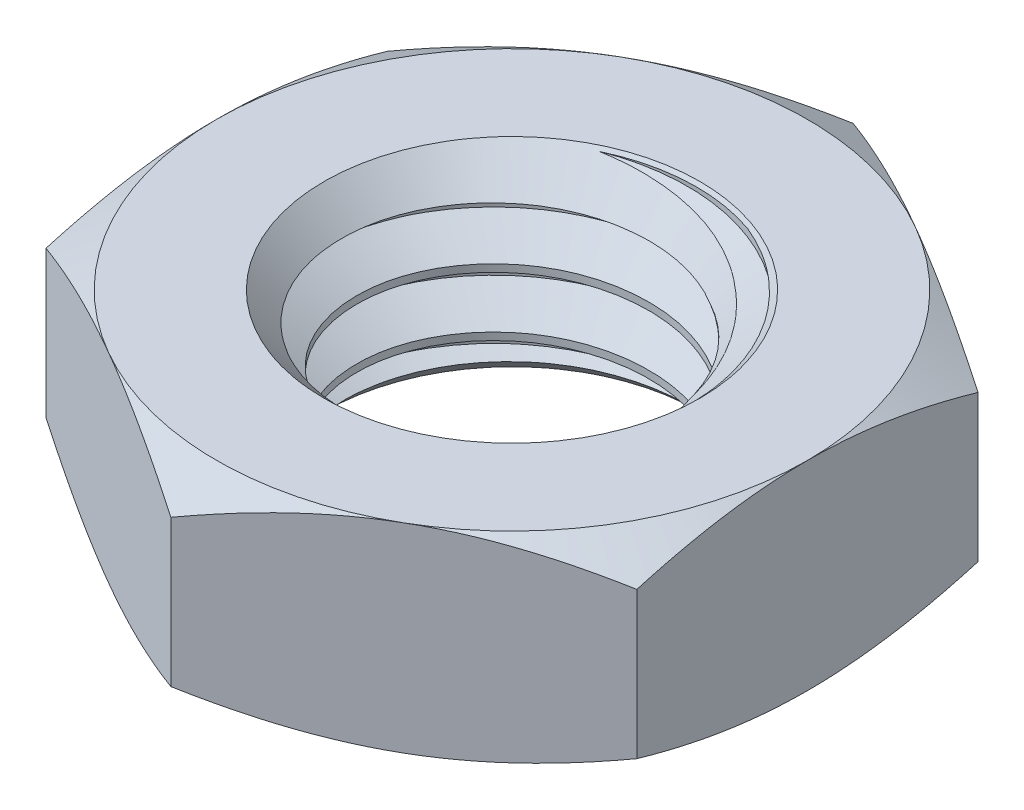
from build123d import *

# Parameters (mm, degrees)
SKETCH1_R                    = 2.5
BOSS_EXTRUDE1_DEPTH          = 1.35
SKETCH5_OUTSIDE_W            = 39.108
SKETCH5_OUTSIDE_H            = 40.346
SKETCH5_OUTSIDE_R            = 4
CUT_EXTRUDE2_DEPTH           = 7.68006986
CUT_EXTRUDE2_DRAFT           = -60
MIRROR1_COPY_1_SKETCH_W      = 39.108
MIRROR1_COPY_1_SKETCH_H      = 40.346
MIRROR1_COPY_1_SKETCH_R      = 4
MIRROR1_COPY_1_DEPTH         = 7.68006986
MIRROR1_COPY_1_DRAFT         = -60
SWEEP1_PITCH                 = 0.8
SKETCH4_R                    = 2.54330127
CUT_EXTRUDE1_DEPTH           = 8.054003107
CUT_EXTRUDE1_OTHER_WAY_DEPTH = 8.054003107
CUT_EXTRUDE1_OTHER_WAY_DRAFT = -45
MIRROR2_COPY_1_SKETCH_R      = 2.54330127
MIRROR2_COPY_1_DEPTH         = 8.054003107
MIRROR2_COPY_1_DRAFT         = -45
MIRROR2_COPY_2_SKETCH_R      = 2.54330127
MIRROR2_COPY_2_DEPTH         = 8.054003107
MIRROR2_COPY_2_DRAFT         = -45


with BuildPart() as part:
    # Sketch1 → Boss-Extrude1 (new, symmetric)
    with BuildSketch(Plane(origin=(0, 0, 0), x_dir=(1, 0, 0), z_dir=(0, 1, 0))):
        Polygon((-4, 2.309401077), (-4, -2.309401077), (0, -4.618802154), (4, -2.309401077), (4, 2.309401077), (0, 4.618802154), align=None)
        with Locations(Location((0, 0, 0), (0, 0, 90))):
            Circle(SKETCH1_R, mode=Mode.SUBTRACT)
    extrude(amount=BOSS_EXTRUDE1_DEPTH, both=True)


with BuildPart() as cut_extrude2_tool:
    # Sketch5 outside → Cut-Extrude2 (with draft: the straight prism first)
    with BuildSketch(Plane(origin=(0, 1.35, 0), x_dir=(1, 0, 0), z_dir=(0, 1, 0))):
        Rectangle(SKETCH5_OUTSIDE_W, SKETCH5_OUTSIDE_H)
        Circle(SKETCH5_OUTSIDE_R, mode=Mode.SUBTRACT)
    extrude(amount=-CUT_EXTRUDE2_DEPTH)
    # Cut-Extrude2: the draft: its side faces are tilted about the plane it starts from
    cut_extrude2_sides = [cut_extrude2_tool.faces().sort_by_distance(p)[0] for p in [
        (0, -2.49003493, 20.173),
        (19.554, -2.49003493, 0),
        (0, -2.49003493, -20.173),
        (-19.554, -2.49003493, 0),
        (-4, -2.49003493, 0),
    ]]
    draft(cut_extrude2_sides, Plane(origin=(0, 1.35, 0), x_dir=(1, 0, 0), z_dir=(0, 1, 0)), CUT_EXTRUDE2_DRAFT)


with BuildPart() as part_1:
    add(part.part)

    # Cut-Extrude2: cut by cut_extrude2_tool
    add(cut_extrude2_tool.part, mode=Mode.SUBTRACT)


with BuildPart() as mirror1_copy_1_tool:
    # Mirror1 copy 1 sketch → Mirror1 copy 1 (with draft: the straight prism first)
    with BuildSketch(Plane.XZ.offset(1.35)):
        Rectangle(MIRROR1_COPY_1_SKETCH_W, MIRROR1_COPY_1_SKETCH_H)
        Circle(MIRROR1_COPY_1_SKETCH_R, mode=Mode.SUBTRACT)
    extrude(amount=-MIRROR1_COPY_1_DEPTH)
    # Mirror1 copy 1: the draft: its side faces are tilted about the plane it starts from
    mirror1_copy_1_sides = [mirror1_copy_1_tool.faces().sort_by_distance(p)[0] for p in [
        (0, 2.49003493, 20.173),
        (19.554, 2.49003493, 0),
        (0, 2.49003493, -20.173),
        (-19.554, 2.49003493, 0),
        (-4, 2.49003493, 0),
    ]]
    draft(mirror1_copy_1_sides, Plane.XZ.offset(1.35), MIRROR1_COPY_1_DRAFT)


with BuildPart() as part_2:
    add(part_1.part)

    # Mirror1 copy 1: cut by mirror1_copy_1_tool
    add(mirror1_copy_1_tool.part, mode=Mode.SUBTRACT)

    # Sweep1: arcs per turn and ends read off the stored shape
    # Sweep1: the profile of Sketch3 screwed along a right-hand helix through 4.375 turns, 8 arcs to a turn; built about Z, then put on its axis
    sweep1_z = Axis((0, 0, 0), (0, 0, 1))
    sweep1_corners = [(1.980384758, 0, -0.3), (1.980384758, 0, -0.4), (2.54330127, 0, -0.725), (2.54330127, 0, 0.025)]
    with BuildLine(mode=Mode.PRIVATE) as sweep1_profile:
        Line(sweep1_corners[0], sweep1_corners[1])
        Line(sweep1_corners[1], sweep1_corners[2])
        Line(sweep1_corners[2], sweep1_corners[3])
        Line(sweep1_corners[3], sweep1_corners[0])
    sweep1_cap = Face(sweep1_profile.wire())
    sweep1_turn_angles = [0, 22.5, 45, 67.5, 90, 112.5, 135, 157.5, 180, 202.5, 225, 247.5, 270, 292.5, 315, 337.5, 360]
    sweep1_turn_weights = [1, 0.9238795325112867, 1, 0.9238795325112867, 1, 0.9238795325112867, 1, 0.9238795325112867, 1, 0.9238795325112867, 1, 0.9238795325112867, 1, 0.9238795325112867, 1, 0.9238795325112867, 1]
    sweep1_turn_rails = [Edge.make_bspline([Vector(p[0], p[1], 0).rotate(sweep1_z, sweep1_turn_angles[k]) / sweep1_turn_weights[k] + Vector(0, 0, p[2] + SWEEP1_PITCH * sweep1_turn_angles[k] / 360) for k in range(17)], [0, 0, 0, 1, 1, 2, 2, 3, 3, 4, 4, 5, 5, 6, 6, 7, 7, 8, 8, 8], 2, sweep1_turn_weights) for p in sweep1_corners]
    sweep1_turn_sides = [Face.make_surface_from_curves(sweep1_turn_rails[p[0]], sweep1_turn_rails[p[1]]) for p in [(0, 1), (1, 2), (2, 3), (3, 0)]]
    sweep1_last_angles = [1440, 1462.5, 1485, 1507.5, 1530, 1552.5, 1575]
    sweep1_last_weights = [1, 0.9238795325112867, 1, 0.9238795325112867, 1, 0.9238795325112776, 1]
    sweep1_last_rails = [Edge.make_bspline([Vector(p[0], p[1], 0).rotate(sweep1_z, sweep1_last_angles[k]) / sweep1_last_weights[k] + Vector(0, 0, p[2] + SWEEP1_PITCH * sweep1_last_angles[k] / 360) for k in range(7)], [0, 0, 0, 1, 1, 2, 2, 3, 3, 3], 2, sweep1_last_weights) for p in sweep1_corners]
    sweep1_last_sides = [Face.make_surface_from_curves(sweep1_last_rails[p[0]], sweep1_last_rails[p[1]]) for p in [(0, 1), (1, 2), (2, 3), (3, 0)]]
    sweep1 = Plane(origin=(0, 1.35, 0), x_dir=(0, 0, -1), z_dir=(0, -1, 0)) * Solid(Shell([*[p.moved(Location((0, 0, SWEEP1_PITCH * i))) for i in range(4) for p in sweep1_turn_sides], *sweep1_last_sides, sweep1_cap, sweep1_cap.rotate(sweep1_z, 1575).moved(Location((0, 0, SWEEP1_PITCH * 1575 / 360)))]))
    add(sweep1)

    # Sketch4 → Cut-Extrude1 (cut)
    with BuildSketch(Plane(origin=(0, 1.35, 0), x_dir=(1, 0, 0), z_dir=(0, 1, 0))):
        Circle(SKETCH4_R)
    cut_extrude1 = extrude(amount=CUT_EXTRUDE1_DEPTH, mode=Mode.SUBTRACT)


with BuildPart() as cut_extrude1_other_way_tool:
    # Sketch4 → Cut-Extrude1 other way (with draft: the straight prism first)
    with BuildSketch(Plane(origin=(0, 1.35, 0), x_dir=(1, 0, 0), z_dir=(0, 1, 0))):
        Circle(SKETCH4_R)
    extrude(amount=-CUT_EXTRUDE1_OTHER_WAY_DEPTH)
    # Cut-Extrude1 other way: the draft: its side faces are tilted about the plane it starts from
    cut_extrude1_other_way_sides = [cut_extrude1_other_way_tool.faces().sort_by_distance(p)[0] for p in [
        (-2.54330127, -2.677001554, 0),
    ]]
    draft(cut_extrude1_other_way_sides, Plane(origin=(0, 1.35, 0), x_dir=(1, 0, 0), z_dir=(0, 1, 0)), CUT_EXTRUDE1_OTHER_WAY_DRAFT)


with BuildPart() as part_3:
    add(part_2.part)

    # Cut-Extrude1 other way: cut by cut_extrude1_other_way_tool
    add(cut_extrude1_other_way_tool.part, mode=Mode.SUBTRACT)

    # Mirror2: Cut-Extrude1 across plane
    add(cut_extrude1.mirror(Plane.ZX), mode=Mode.SUBTRACT)


with BuildPart() as mirror2_copy_1_tool:
    # Mirror2 copy 1 sketch → Mirror2 copy 1 (with draft: the straight prism first)
    with BuildSketch(Plane.XZ.offset(1.35)):
        Circle(MIRROR2_COPY_1_SKETCH_R)
    extrude(amount=-MIRROR2_COPY_1_DEPTH)
    # Mirror2 copy 1: the draft: its side faces are tilted about the plane it starts from
    mirror2_copy_1_sides = [mirror2_copy_1_tool.faces().sort_by_distance(p)[0] for p in [
        (-2.54330127, 2.677001554, 0),
    ]]
    draft(mirror2_copy_1_sides, Plane.XZ.offset(1.35), MIRROR2_COPY_1_DRAFT)


with BuildPart() as part_4:
    add(part_3.part)

    # Mirror2 copy 1: cut by mirror2_copy_1_tool
    add(mirror2_copy_1_tool.part, mode=Mode.SUBTRACT)


with BuildPart() as mirror2_copy_2_tool:
    # Mirror2 copy 2 sketch → Mirror2 copy 2 (with draft: the straight prism first)
    with BuildSketch(Plane.XZ.offset(1.35)):
        Circle(MIRROR2_COPY_2_SKETCH_R)
    extrude(amount=-MIRROR2_COPY_2_DEPTH)
    # Mirror2 copy 2: the draft: its side faces are tilted about the plane it starts from
    mirror2_copy_2_sides = [mirror2_copy_2_tool.faces().sort_by_distance(p)[0] for p in [
        (-2.54330127, 2.677001554, 0),
    ]]
    draft(mirror2_copy_2_sides, Plane.XZ.offset(1.35), MIRROR2_COPY_2_DRAFT)


with BuildPart() as part_5:
    add(part_4.part)

    # Mirror2 copy 2: cut by mirror2_copy_2_tool
    add(mirror2_copy_2_tool.part, mode=Mode.SUBTRACT)


solid = part_5.part
